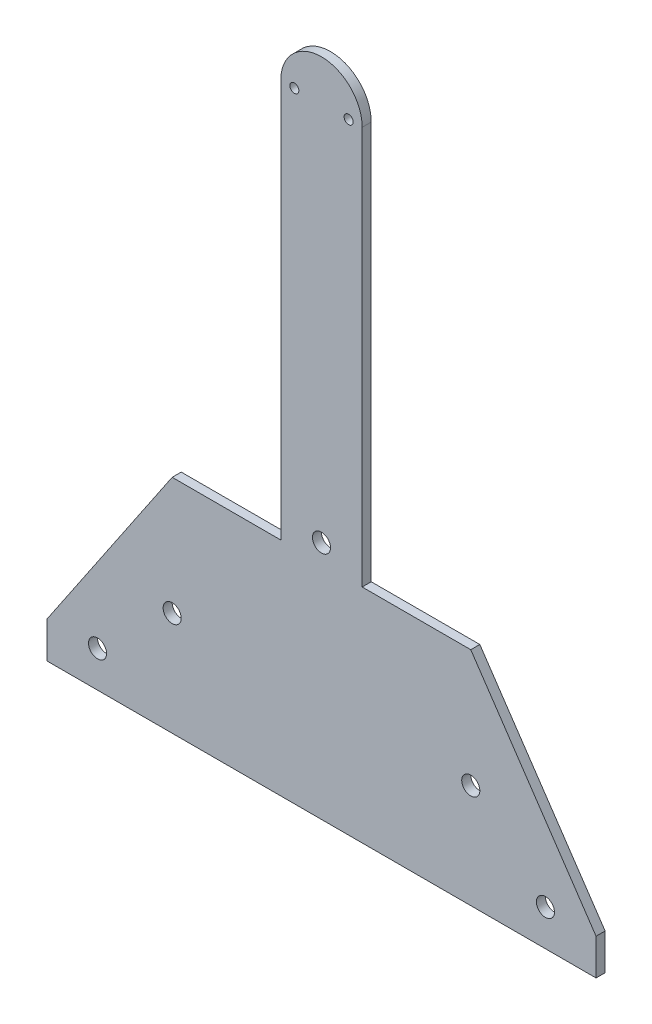
from build123d import *

# Parameters (mm, degrees)
SKETCH_1_R      = 2
SKETCH_1_R_2    = 1
EXTRUDE_1_DEPTH = 2


with BuildPart() as part:
    # 草图1 → 凸台-拉伸1 (new body)
    with BuildSketch(Plane.XY):
        with BuildLine():
            ThreePointArc((8.708571429, 121.645714286), (-0.291428571, 130.645714286), (-9.291428571, 121.645714286))
            Line((-9.291428571, 121.645714286), (-9.291428571, 33.645714286))
            Line((-9.291428571, 33.645714286), (-33.291428571, 33.645714286))
            Line((-33.291428571, 33.645714286), (-60.986481548, -7.354285714))
            Line((-60.986481548, -7.354285714), (-60.986481548, -15.354285714))
            Line((-60.986481548, -15.354285714), (-0.582857143, -15.354285714))
            Line((-0.582857143, -15.354285714), (0, -15.354285714))
            Line((0, -15.354285714), (60.403624405, -15.354285714))
            Line((60.403624405, -15.354285714), (60.403624405, -7.354285714))
            Line((60.403624405, -7.354285714), (32.708571429, 33.645714286))
            Line((32.708571429, 33.645714286), (8.708571429, 33.645714286))
            Line((8.708571429, 33.645714286), (8.708571429, 121.645714286))
        make_face()
        with Locations((-49.791428571, -7.354285714)):
            Circle(SKETCH_1_R, mode=Mode.SUBTRACT)
        with Locations((-33.291428571, 7.645714286)):
            Circle(SKETCH_1_R, mode=Mode.SUBTRACT)
        with Locations((-0.291428571, 37.645714286)):
            Circle(SKETCH_1_R, mode=Mode.SUBTRACT)
        with Locations((49.208571429, -7.354285714)):
            Circle(SKETCH_1_R, mode=Mode.SUBTRACT)
        with Locations((32.708571429, 7.645714286)):
            Circle(SKETCH_1_R, mode=Mode.SUBTRACT)
        with Locations((-6.291428571, 121.645714286)):
            Circle(SKETCH_1_R_2, mode=Mode.SUBTRACT)
        with Locations((5.708571429, 121.645714286)):
            Circle(SKETCH_1_R_2, mode=Mode.SUBTRACT)
    extrude(amount=EXTRUDE_1_DEPTH)


solid = part.part
